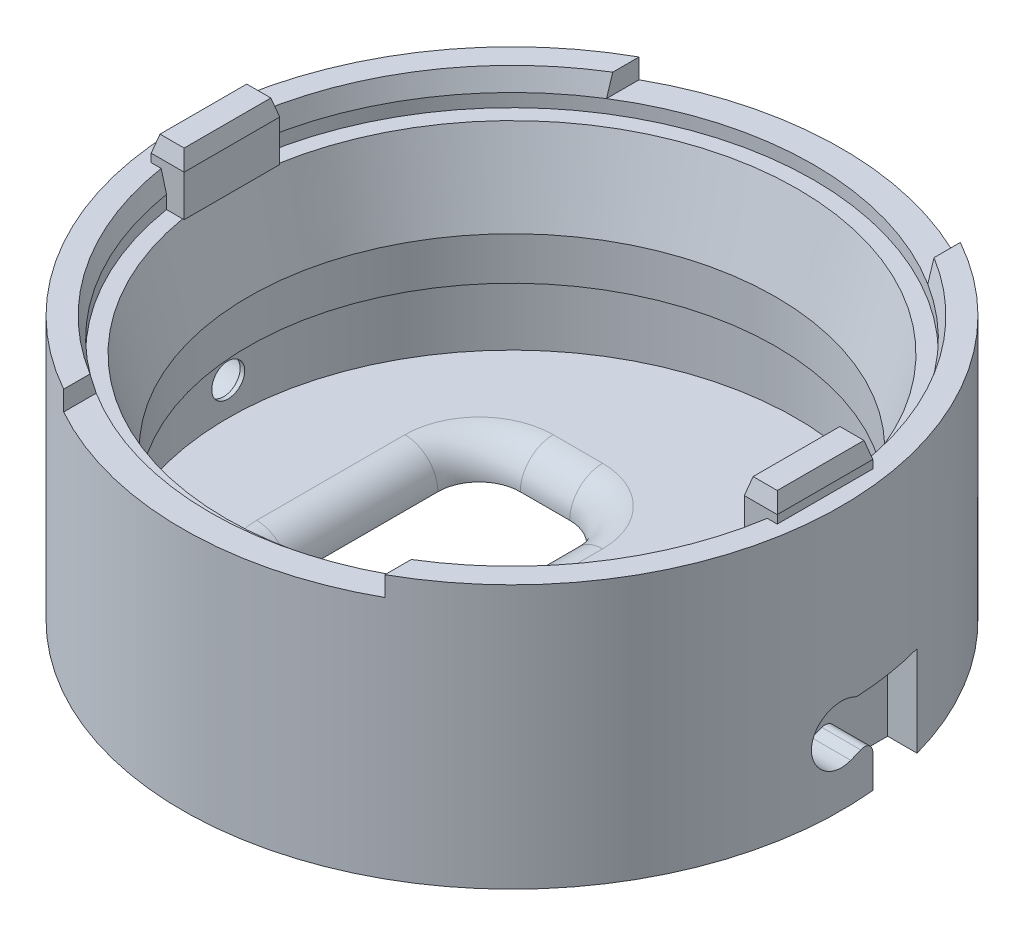
from build123d import *
from OCP.BRepFilletAPI import BRepFilletAPI_MakeChamfer

# Parameters (mm, degrees)
SKIZZE1_R                        = 20
AUFSATZ_LINEAR_AUSTRAGEN1_DEPTH  = 16
SKIZZE2_R                        = 16
SCHNITT_LINEAR_AUSTRAGEN1_DEPTH  = 14
SCHNITT_LINEAR_AUSTRAGEN4_DEPTH  = 2.5
SKIZZE12_R                       = 1
SCHNITT_LINEAR_AUSTRAGEN9_DEPTH  = 2
SKIZZE16_W                       = 4.509256524
SKIZZE16_H                       = 2.858569563
SCHNITT_LINEAR_AUSTRAGEN13_DEPTH = 0.1
KREISMUSTER1_COUNT               = 2
SKIZZE5_R                        = 17.25
SCHNITT_LINEAR_AUSTRAGEN5_DEPTH  = 4.4
VERRUNDUNG3_R                    = 0.6
SKIZZE8_R                        = 5
SCHNITT_LINEAR_AUSTRAGEN7_DEPTH  = 4
SKIZZE9_R                        = 18.3
SCHNITT_LINEAR_AUSTRAGEN8_DEPTH  = 2
FASE4_SIZE                       = 1.2
FASE4_SIZE2                      = 0.321539031
FASE7_SIZE                       = 5
FASE7_SIZE2                      = 1.339745962
SKIZZE14_W                       = 19.5
SKIZZE14_H                       = 42.780775224
SCHNITT_LINEAR_AUSTRAGEN12_DEPTH = 1.2
VERRUNDUNG4_R                    = 2
SKIZZE15_W                       = 2
SKIZZE15_H                       = 5.8
AUFSATZ_LINEAR_AUSTRAGEN7_DEPTH  = 3.5
FASE8_SIZE                       = 1
FASE8_SIZE2                      = 0.267949192
KREISMUSTER2_COUNT               = 2
FASE8_OF_KREISMUSTER2_SIZE       = 1
FASE8_OF_KREISMUSTER2_SIZE2      = 0.267949192


# Some blends are built 0.0001 mm under size
with BuildPart() as part:
    # Skizze1 → Aufsatz-Linear austragen1 (new body)
    with BuildSketch(Plane(origin=(0, 0, 0), x_dir=(1, 0, 0), z_dir=(0, 1, 0))):
        with Locations(Location((0, 0, 0), (0, 0, 270))):
            Circle(SKIZZE1_R)
    extrude(amount=AUFSATZ_LINEAR_AUSTRAGEN1_DEPTH)

    # Skizze2 → Schnitt-Linear austragen1 (cut)
    with BuildSketch(Plane(origin=(0, 16, 0), x_dir=(1, 0, 0), z_dir=(0, 1, 0))):
        with Locations(Location((0, 0, 0), (0, 0, 270))):
            Circle(SKIZZE2_R)
    extrude(amount=-SCHNITT_LINEAR_AUSTRAGEN1_DEPTH, mode=Mode.SUBTRACT)

    # Skizze3 → Schnitt-Linear austragen4 (cut)
    with BuildSketch(Plane(origin=(-20, 0, -20), x_dir=(0, 0, 1), z_dir=(-1, 0, 0))):
        with BuildLine():
            Line((22, 2.840208943), (22, 0))
            Line((22, 0), (25.3, 0))
            Line((25.3, 0), (25.3, 5.5))
            Line((25.3, 5.5), (20.901387819, 5.5))
            ThreePointArc((20.901387819, 5.5), (18.2594548, 4.181665647), (20.572216311, 2.346195751))
            Line((20.572216311, 2.346195751), (22, 2.840208943))
        make_face()
    schnitt_linear_austragen4 = extrude(amount=-SCHNITT_LINEAR_AUSTRAGEN4_DEPTH, mode=Mode.SUBTRACT)

    # Skizze12 → Schnitt-Linear austragen9 (cut)
    with BuildSketch(Plane.ZY.offset(17.5)):
        with Locations((0, 4)):
            Circle(SKIZZE12_R)
    schnitt_linear_austragen9 = extrude(amount=-SCHNITT_LINEAR_AUSTRAGEN9_DEPTH, mode=Mode.SUBTRACT)

    # Skizze16 → Schnitt-Linear austragen13 (cut)
    with BuildSketch(Plane.ZY.offset(17.5)):
        with Locations((-0.184707944, 1.429284782)):
            Rectangle(SKIZZE16_W, SKIZZE16_H)
    schnitt_linear_austragen13 = extrude(amount=SCHNITT_LINEAR_AUSTRAGEN13_DEPTH, mode=Mode.SUBTRACT)

    # Kreismuster1: Schnitt-Linear austragen4, Schnitt-Linear austragen9, Schnitt-Linear austragen13 ×2 about axis
    kreismuster1_axis = Axis((0, 0, 0), (0, 1, 0))
    add([schnitt_linear_austragen4.rotate(kreismuster1_axis, i * 360 / KREISMUSTER1_COUNT) for i in range(1, KREISMUSTER1_COUNT)], mode=Mode.SUBTRACT)
    add([schnitt_linear_austragen9.rotate(kreismuster1_axis, i * 360 / KREISMUSTER1_COUNT) for i in range(1, KREISMUSTER1_COUNT)], mode=Mode.SUBTRACT)
    add([schnitt_linear_austragen13.rotate(kreismuster1_axis, i * 360 / KREISMUSTER1_COUNT) for i in range(1, KREISMUSTER1_COUNT)], mode=Mode.SUBTRACT)

    # Skizze5 → Schnitt-Linear austragen5 (cut)
    with BuildSketch(Plane(origin=(0, 2, 0), x_dir=(1, 0, 0), z_dir=(0, 1, 0))):
        with Locations(Location((0, 0, 0), (0, 0, 270))):
            Circle(SKIZZE5_R)
    extrude(amount=SCHNITT_LINEAR_AUSTRAGEN5_DEPTH, mode=Mode.SUBTRACT)

    # Verrundung3
    # the kernel refuses this fillet: 0.6 mm, written as the material it adds along each edge
    with BuildSketch(Plane(origin=(-20.78496824, 5.5, 5.3), x_dir=(0, -1, 0), z_dir=(1, 0, 0))) as verrundung3_piece_1_section:
        with BuildLine():
            CenterArc((VERRUNDUNG3_R, VERRUNDUNG3_R), VERRUNDUNG3_R, 180, 90)
            Line((0, VERRUNDUNG3_R), (-VERRUNDUNG3_R * 0.02, VERRUNDUNG3_R))
            Line((-VERRUNDUNG3_R * 0.02, VERRUNDUNG3_R), (-VERRUNDUNG3_R * 0.02, -VERRUNDUNG3_R * 0.02))
            Line((-VERRUNDUNG3_R * 0.02, -VERRUNDUNG3_R * 0.02), (VERRUNDUNG3_R, -VERRUNDUNG3_R * 0.02))
            Line((VERRUNDUNG3_R, -VERRUNDUNG3_R * 0.02), (VERRUNDUNG3_R, 0))
        make_face()
    verrundung3_piece_1 = extrude(amount=3.28496824, mode=Mode.PRIVATE)
    verrundung3_piece_1 = verrundung3_piece_1 & Plane(origin=(0, 5.365601282, 0), x_dir=(0, 0, 1), z_dir=(0, -1, 0)) * Cylinder(20, 9, mode=Mode.PRIVATE)
    add(verrundung3_piece_1)
    # the kernel refuses this fillet: 0.6 mm, written as the material it takes off along each edge
    with BuildSketch(Plane(origin=(-22.005998299, 2.840208943, 2), x_dir=(0, -1, 0), z_dir=(1, 0, 0))) as verrundung3_2_piece_1_section:
        with BuildLine():
            CenterArc((VERRUNDUNG3_R * 1.40416637136, VERRUNDUNG3_R), VERRUNDUNG3_R, 160.914378655, 109.085621345)
            Line((VERRUNDUNG3_R * 0.459135372033, VERRUNDUNG3_R * 1.32698074915), (VERRUNDUNG3_R * 0.440234752046, VERRUNDUNG3_R * 1.33352036413))
            Line((VERRUNDUNG3_R * 0.440234752046, VERRUNDUNG3_R * 1.33352036413), (-VERRUNDUNG3_R * 0.0280833274272, -VERRUNDUNG3_R * 0.02))
            Line((-VERRUNDUNG3_R * 0.0280833274272, -VERRUNDUNG3_R * 0.02), (VERRUNDUNG3_R * 1.40416637136, -VERRUNDUNG3_R * 0.02))
            Line((VERRUNDUNG3_R * 1.40416637136, -VERRUNDUNG3_R * 0.02), (VERRUNDUNG3_R * 1.40416637136, 0))
        make_face()
    verrundung3_2_piece_1 = extrude(amount=4.405998299, mode=Mode.PRIVATE)
    verrundung3_2_piece_1 = verrundung3_2_piece_1 & Plane(origin=(0, 2.575482177, 0), x_dir=(0, 0, 1), z_dir=(0, -1, 0)) * Cylinder(20, 13, mode=Mode.PRIVATE)
    add(verrundung3_2_piece_1, mode=Mode.SUBTRACT)
    with BuildSketch(Plane(origin=(22.005998299, 2.840208943, -2), x_dir=(0, -1, 0), z_dir=(-1, 0, 0))) as verrundung3_2_piece_2_section:
        with BuildLine():
            CenterArc((VERRUNDUNG3_R * 1.40416637136, VERRUNDUNG3_R), VERRUNDUNG3_R, 160.914378655, 109.085621345)
            Line((VERRUNDUNG3_R * 0.459135372033, VERRUNDUNG3_R * 1.32698074915), (VERRUNDUNG3_R * 0.440234752046, VERRUNDUNG3_R * 1.33352036413))
            Line((VERRUNDUNG3_R * 0.440234752046, VERRUNDUNG3_R * 1.33352036413), (-VERRUNDUNG3_R * 0.0280833274272, -VERRUNDUNG3_R * 0.02))
            Line((-VERRUNDUNG3_R * 0.0280833274272, -VERRUNDUNG3_R * 0.02), (VERRUNDUNG3_R * 1.40416637136, -VERRUNDUNG3_R * 0.02))
            Line((VERRUNDUNG3_R * 1.40416637136, -VERRUNDUNG3_R * 0.02), (VERRUNDUNG3_R * 1.40416637136, 0))
        make_face()
    verrundung3_2_piece_2 = extrude(amount=4.405998299, mode=Mode.PRIVATE)
    verrundung3_2_piece_2 = verrundung3_2_piece_2 & Plane(origin=(0, 2.575481894, 0), x_dir=(0, 0, 1), z_dir=(0, -1, 0)) * Cylinder(20, 13, mode=Mode.PRIVATE)
    add(verrundung3_2_piece_2, mode=Mode.SUBTRACT)
    with BuildSketch(Plane(origin=(20.363085516, 5.5, -0.901387819), x_dir=(0, 0.4822994369983442, 0.8760064229622294), z_dir=(-1, 0, 0))) as verrundung3_2_piece_3_section:
        with BuildLine():
            CenterArc((0.155032394, 0.599570905), VERRUNDUNG3_R, 241.164310134, 26.668660597)
            Line((-0.134347268, 0.073967051), (-0.140134861, 0.063454974))
            Line((-0.140134861, 0.063454974), (-0.005787593, -0.010512077))
            Line((-0.005787593, -0.010512077), (0.000453753, -0.011991418))
            ThreePointArc((0.000453753, -0.011991418), (0.066172363, -0.010748472), (0.131890973, -0.011991418))
            Line((0.131890973, -0.011991418), (0.132344727, 0))
        make_face()
    verrundung3_2_piece_3 = extrude(amount=2.863085516, mode=Mode.PRIVATE)
    verrundung3_2_piece_3 = verrundung3_2_piece_3 & Plane(origin=(0, 5.510677153, 0), x_dir=(0, 0, 1), z_dir=(0, -1, 0)) * Cylinder(20, 7, mode=Mode.PRIVATE)
    add(verrundung3_2_piece_3, mode=Mode.SUBTRACT)
    with BuildSketch(Plane(origin=(-20.363085516, 5.5, 0.901387819), x_dir=(0, 0.4822994369983449, -0.876006422962229), z_dir=(1, 0, 0))) as verrundung3_2_piece_4_section:
        with BuildLine():
            CenterArc((0.155032394, 0.599570905), VERRUNDUNG3_R, 241.164310134, 26.668660597)
            Line((-0.134347268, 0.073967051), (-0.140134861, 0.063454974))
            Line((-0.140134861, 0.063454974), (-0.005787593, -0.010512077))
            Line((-0.005787593, -0.010512077), (0.000453753, -0.011991418))
            ThreePointArc((0.000453753, -0.011991418), (0.066172363, -0.010748472), (0.131890973, -0.011991418))
            Line((0.131890973, -0.011991418), (0.132344727, 0))
        make_face()
    verrundung3_2_piece_4 = extrude(amount=2.863085516, mode=Mode.PRIVATE)
    verrundung3_2_piece_4 = verrundung3_2_piece_4 & Plane(origin=(0, 5.510677153, 0), x_dir=(0, 0, 1), z_dir=(0, -1, 0)) * Cylinder(20, 7, mode=Mode.PRIVATE)
    add(verrundung3_2_piece_4, mode=Mode.SUBTRACT)
    with BuildSketch(Plane(origin=(-20.78496824, 0, 5.3), x_dir=(0, 0, 1), z_dir=(1, 0, 0))) as verrundung3_2_piece_5_section:
        with BuildLine():
            CenterArc((VERRUNDUNG3_R, -VERRUNDUNG3_R), VERRUNDUNG3_R, 90, 90)
            Line((0, -VERRUNDUNG3_R), (-VERRUNDUNG3_R * 0.02, -VERRUNDUNG3_R))
            Line((-VERRUNDUNG3_R * 0.02, -VERRUNDUNG3_R), (-VERRUNDUNG3_R * 0.02, VERRUNDUNG3_R * 0.02))
            Line((-VERRUNDUNG3_R * 0.02, VERRUNDUNG3_R * 0.02), (VERRUNDUNG3_R, VERRUNDUNG3_R * 0.02))
            Line((VERRUNDUNG3_R, VERRUNDUNG3_R * 0.02), (VERRUNDUNG3_R, 0))
        make_face()
    verrundung3_2_piece_5 = extrude(amount=3.28496824, mode=Mode.PRIVATE)
    verrundung3_2_piece_5 = verrundung3_2_piece_5 & Plane(origin=(0, 0.137448378, 0), x_dir=(0, 0, 1), z_dir=(0, -1, 0)) * Cylinder(20, 9, mode=Mode.PRIVATE)
    add(verrundung3_2_piece_5, mode=Mode.SUBTRACT)
    with BuildSketch(Plane(origin=(-21.399748742, 0, 2), x_dir=(0, 0, -1), z_dir=(1, 0, 0))) as verrundung3_2_piece_6_section:
        with BuildLine():
            CenterArc((VERRUNDUNG3_R, VERRUNDUNG3_R), VERRUNDUNG3_R, 180, 90)
            Line((0, VERRUNDUNG3_R), (-VERRUNDUNG3_R * 0.02, VERRUNDUNG3_R))
            Line((-VERRUNDUNG3_R * 0.02, VERRUNDUNG3_R), (-VERRUNDUNG3_R * 0.02, -VERRUNDUNG3_R * 0.02))
            Line((-VERRUNDUNG3_R * 0.02, -VERRUNDUNG3_R * 0.02), (VERRUNDUNG3_R, -VERRUNDUNG3_R * 0.02))
            Line((VERRUNDUNG3_R, -VERRUNDUNG3_R * 0.02), (VERRUNDUNG3_R, 0))
        make_face()
    verrundung3_2_piece_6 = extrude(amount=3.799748742, mode=Mode.PRIVATE)
    verrundung3_2_piece_6 = verrundung3_2_piece_6 & Plane(origin=(0, 0.13544573, 0), x_dir=(0, 0, 1), z_dir=(0, -1, 0)) * Cylinder(20, 10, mode=Mode.PRIVATE)
    add(verrundung3_2_piece_6, mode=Mode.SUBTRACT)

    # Skizze8 → Schnitt-Linear austragen7 (cut)
    with BuildSketch(Plane(origin=(0, 2, 0), x_dir=(1, 0, 0), z_dir=(0, 1, 0))):
        with Locations(Location((8.140295254, 0, 0), (0, 0, 270))):
            Circle(SKIZZE8_R)
        with BuildLine():
            Line((-3.5, 7), (-6.5, 7))
            ThreePointArc((-6.5, 7), (-8.267766953, 6.267766953), (-9, 4.5))
            Line((-9, 4.5), (-9, -4.5))
            ThreePointArc((-9, -4.5), (-8.267766953, -6.267766953), (-6.5, -7))
            Line((-6.5, -7), (-3.5, -7))
            ThreePointArc((-3.5, -7), (-1.732233047, -6.267766953), (-1, -4.5))
            Line((-1, -4.5), (-1, 4.5))
            ThreePointArc((-1, 4.5), (-1.732233047, 6.267766953), (-3.5, 7))
        make_face()
    extrude(amount=-SCHNITT_LINEAR_AUSTRAGEN7_DEPTH, mode=Mode.SUBTRACT)

    # Skizze9 → Schnitt-Linear austragen8 (cut)
    with BuildSketch(Plane(origin=(0, 16, 0), x_dir=(1, 0, 0), z_dir=(0, 1, 0))):
        with Locations(Location((0, 0, 0), (0, 0, 270))):
            Circle(SKIZZE9_R)
    extrude(amount=-SCHNITT_LINEAR_AUSTRAGEN8_DEPTH, mode=Mode.SUBTRACT)

    # Fase4
    fase4_edges = [part.edges().sort_by_distance(p)[0] for p in [
        (0, 16, -18.3),
    ]]
    fase4_side = [part.faces().sort_by_distance(p)[0] for p in [
        (0, 15, -18.3),
    ]]
    chamfer(fase4_edges, length=FASE4_SIZE, length2=FASE4_SIZE2, reference=fase4_side[0])

    # Fase7
    fase7_edges = [part.edges().sort_by_distance(p)[0] for p in [
        (0, 14, -16),
    ]]
    fase7_side = [part.faces().sort_by_distance(p)[0] for p in [
        (0, 10.2, -16),
    ]]
    chamfer(fase7_edges, length=FASE7_SIZE, length2=FASE7_SIZE2, reference=fase7_side[0])

    # Skizze14 → Schnitt-Linear austragen12 (cut)
    with BuildSketch(Plane(origin=(0, 16, 0), x_dir=(1, 0, 0), z_dir=(0, 1, 0))):
        with Locations((0, 0.396118289)):
            Rectangle(SKIZZE14_W, SKIZZE14_H)
    extrude(amount=-SCHNITT_LINEAR_AUSTRAGEN12_DEPTH, mode=Mode.SUBTRACT)

    # Verrundung4
    verrundung4_edges = [part.edges().sort_by_distance(p)[0] for p in [
        (-1.732233047, 2, -6.267766953),
        (-5, 2, -7),
        (-8.267766953, 2, -6.267766953),
        (-9, 2, 0),
        (-8.267766953, 2, 6.267766953),
        (-5, 2, 7),
        (-1.732233047, 2, 6.267766953),
        (-1, 2, 0),
        (8.140295254, 2, -5),
    ]]
    fillet(verrundung4_edges, radius=VERRUNDUNG4_R - 0.0001)  # a hair under: the kernel refuses the full size

    # Skizze15 → Aufsatz-Linear austragen7 (add)
    with BuildSketch(Plane(origin=(0, 14, 0), x_dir=(1, 0, 0), z_dir=(0, 1, 0))):
        with Locations((-18, 0)):
            Rectangle(SKIZZE15_W, SKIZZE15_H)
    aufsatz_linear_austragen7 = extrude(amount=AUFSATZ_LINEAR_AUSTRAGEN7_DEPTH)

    # Fase8: one chamfer whose edges measure the first distance from different faces: ONE call of the kernel's chamfer builder (chamfer() names one face for all edges)
    fase8_edges_1 = [part.edges().sort_by_distance(p)[0] for p in [
        (-18, 17.5, -2.9),
    ]]
    fase8_side_1 = [part.faces().sort_by_distance(p)[0] for p in [
        (-17.819865261, 16.006438669, -2.9),
    ]]
    fase8_edges_2 = [part.edges().sort_by_distance(p)[0] for p in [
        (-17, 17.5, 0),
    ]]
    fase8_side_2 = [part.faces().sort_by_distance(p)[0] for p in [
        (-17, 15.75, 0),
    ]]
    fase8_edges_3 = [part.edges().sort_by_distance(p)[0] for p in [
        (-19, 17.5, 0),
    ]]
    fase8_side_3 = [part.faces().sort_by_distance(p)[0] for p in [
        (-19, 16.75, 0),
    ]]
    fase8_edges_4 = [part.edges().sort_by_distance(p)[0] for p in [
        (-18, 17.5, 2.9),
    ]]
    fase8_side_4 = [part.faces().sort_by_distance(p)[0] for p in [
        (-17.819865261, 16.006438669, 2.9),
    ]]
    fase8 = BRepFilletAPI_MakeChamfer(part.part.solid().wrapped)
    for e in fase8_edges_1:
        fase8.Add(FASE8_SIZE, FASE8_SIZE2, e.wrapped, fase8_side_1[0].wrapped)  # the first distance lies on this face
    for e in fase8_edges_2:
        fase8.Add(FASE8_SIZE, FASE8_SIZE2, e.wrapped, fase8_side_2[0].wrapped)  # the first distance lies on this face
    for e in fase8_edges_3:
        fase8.Add(FASE8_SIZE, FASE8_SIZE2, e.wrapped, fase8_side_3[0].wrapped)  # the first distance lies on this face
    for e in fase8_edges_4:
        fase8.Add(FASE8_SIZE, FASE8_SIZE2, e.wrapped, fase8_side_4[0].wrapped)  # the first distance lies on this face
    add(Compound.cast(fase8.Shape()), mode=Mode.REPLACE)

    # Kreismuster2: Aufsatz-Linear austragen7 ×2 about axis
    kreismuster2_axis = Axis((0, 0, 0), (0, 1, 0))
    for i in range(1, KREISMUSTER2_COUNT):
        add(aufsatz_linear_austragen7.rotate(kreismuster2_axis, i * 360 / KREISMUSTER2_COUNT))

    # Fase8 of Kreismuster2: one chamfer whose edges measure the first distance from different faces: ONE call of the kernel's chamfer builder (chamfer() names one face for all edges)
    fase8_of_kreismuster2_edges_1 = [part.edges().sort_by_distance(p)[0] for p in [
        (18, 17.5, 2.9),
    ]]
    fase8_of_kreismuster2_side_1 = [part.faces().sort_by_distance(p)[0] for p in [
        (17.819865261, 16.006438669, 2.9),
    ]]
    fase8_of_kreismuster2_edges_2 = [part.edges().sort_by_distance(p)[0] for p in [
        (17, 17.5, 0),
    ]]
    fase8_of_kreismuster2_side_2 = [part.faces().sort_by_distance(p)[0] for p in [
        (17, 15.75, 0),
    ]]
    fase8_of_kreismuster2_edges_3 = [part.edges().sort_by_distance(p)[0] for p in [
        (19, 17.5, 0),
    ]]
    fase8_of_kreismuster2_side_3 = [part.faces().sort_by_distance(p)[0] for p in [
        (19, 16.75, 0),
    ]]
    fase8_of_kreismuster2_edges_4 = [part.edges().sort_by_distance(p)[0] for p in [
        (18, 17.5, -2.9),
    ]]
    fase8_of_kreismuster2_side_4 = [part.faces().sort_by_distance(p)[0] for p in [
        (17.819865261, 16.006438669, -2.9),
    ]]
    fase8_of_kreismuster2 = BRepFilletAPI_MakeChamfer(part.part.solid().wrapped)
    for e in fase8_of_kreismuster2_edges_1:
        fase8_of_kreismuster2.Add(FASE8_OF_KREISMUSTER2_SIZE, FASE8_OF_KREISMUSTER2_SIZE2, e.wrapped, fase8_of_kreismuster2_side_1[0].wrapped)  # the first distance lies on this face
    for e in fase8_of_kreismuster2_edges_2:
        fase8_of_kreismuster2.Add(FASE8_OF_KREISMUSTER2_SIZE, FASE8_OF_KREISMUSTER2_SIZE2, e.wrapped, fase8_of_kreismuster2_side_2[0].wrapped)  # the first distance lies on this face
    for e in fase8_of_kreismuster2_edges_3:
        fase8_of_kreismuster2.Add(FASE8_OF_KREISMUSTER2_SIZE, FASE8_OF_KREISMUSTER2_SIZE2, e.wrapped, fase8_of_kreismuster2_side_3[0].wrapped)  # the first distance lies on this face
    for e in fase8_of_kreismuster2_edges_4:
        fase8_of_kreismuster2.Add(FASE8_OF_KREISMUSTER2_SIZE, FASE8_OF_KREISMUSTER2_SIZE2, e.wrapped, fase8_of_kreismuster2_side_4[0].wrapped)  # the first distance lies on this face
    add(Compound.cast(fase8_of_kreismuster2.Shape()), mode=Mode.REPLACE)


solid = part.part
